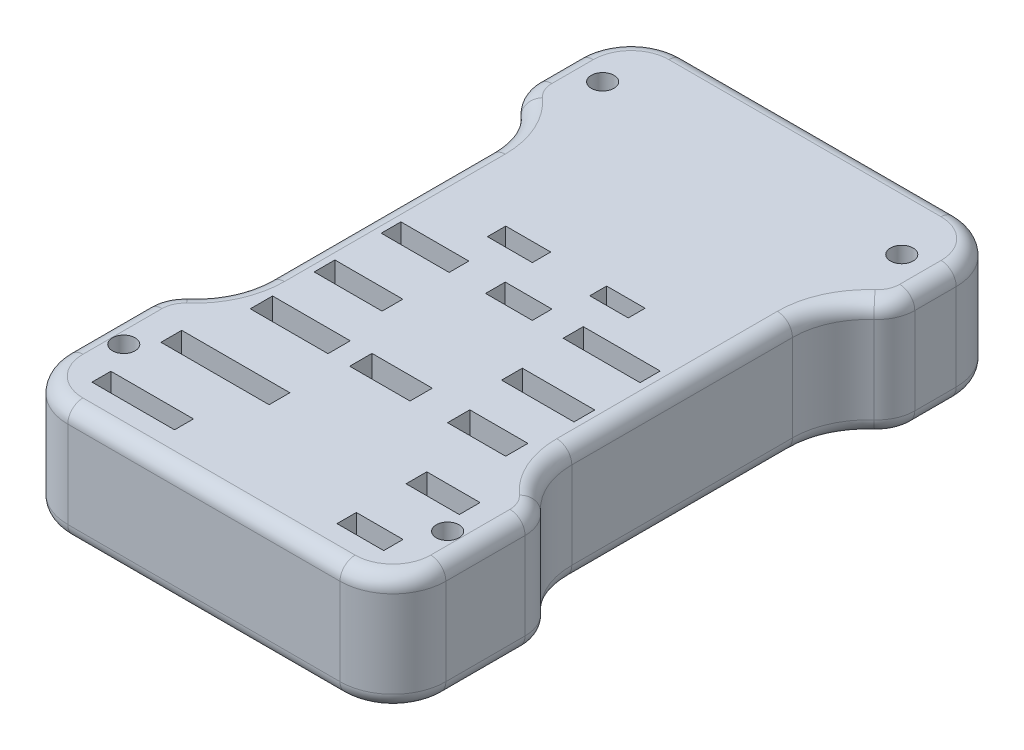
from build123d import *

# Parameters (mm, degrees)
BOSS_EXTRUDE1_DEPTH = 15.5
FILLET1_R           = 7
FILLET2_R           = 10
FILLET3_R           = 5
FILLET4_R           = 2
SKETCH2_R           = 1.5
SKETCH2_W           = 10.92280205
SKETCH2_H           = 2.497802755
SKETCH2_W_2         = 14.300247421
SKETCH2_H_2         = 2.745251167
SKETCH2_W_3         = 6.180006424
SKETCH2_H_3         = 2.556024723
SKETCH2_W_4         = 7.044858218
SKETCH2_W_5         = 10.276057193
SKETCH2_H_4         = 2.946282132
SKETCH2_W_6         = 7.976519918
SKETCH2_W_7         = 7.689077759
SKETCH2_W_8         = 8.982567476
SKETCH2_H_5         = 2.60403982
SKETCH2_W_9         = 6.180006423
SKETCH2_W_10        = 10.172310113
SKETCH2_H_6         = 2.663918404
SKETCH2_W_11        = 5.94485656
SKETCH2_H_7         = 2.427407937
SKETCH2_W_12        = 5.086155057
SKETCH2_H_8         = 2.229246052
SKETCH2_H_9         = 2.744285017
SKETCH2_W_13        = 9.577824458
CUT_EXTRUDE1_DEPTH  = 3.5


with BuildPart() as part:
    # Sketch1 → Boss-Extrude1 (new body)
    with BuildSketch(Plane(origin=(0, 0, 0), x_dir=(1, 0, 0), z_dir=(0, 1, 0))):
        Polygon((25, -40.75), (-25, -40.75), (-25, -20.75), (-20, -20.75), (-20, 25.75), (-25, 25.75), (-25, 40.75), (25, 40.75), (25, 25.75), (20, 25.75), (20, -20.75), (25, -20.75), align=None)
    extrude(amount=BOSS_EXTRUDE1_DEPTH)

    # Fillet1
    fillet1_edges = [part.edges().sort_by_distance(p)[0] for p in [
        (-25, 7.75, -40.75),
        (25, 7.75, -40.75),
        (25, 7.75, 40.75),
        (-25, 7.75, 40.75),
    ]]
    fillet(fillet1_edges, radius=FILLET1_R)

    # Fillet2
    # the kernel refuses this fillet: 10 mm, written as the material it adds along each edge
    with BuildSketch(Plane(origin=(-20, 0, 20.75), x_dir=(-1, 0, 0), z_dir=(0, 1, 0))) as fillet2_piece_1:
        with BuildLine():
            CenterArc((10, -8.660254038), FILLET2_R, 120, 60)
            Line((0, -8.660254038), (-0.2, -8.660254038))
            Line((-0.2, -8.660254038), (-0.2, 0))
            Line((-0.2, 0), (0, 0.2))
            ThreePointArc((0, 0.2), (2.5, 0.2), (4.9, 0.173205081))
            Line((4.9, 0.173205081), (5, 0))
        make_face()
    extrude(amount=15.5)
    with BuildSketch(Plane(origin=(-20, 0, -25.75), x_dir=(0, 0, 1), z_dir=(0, 1, 0))) as fillet2_piece_2:
        with BuildLine():
            CenterArc((8.660254038, -10), FILLET2_R, 90, 60)
            Line((0, -5), (-0.173205081, -4.9))
            ThreePointArc((-0.173205081, -4.9), (-0.2, -2.5), (-0.2, 0))
            Line((-0.2, 0), (0, 0.2))
            Line((0, 0.2), (8.660254038, 0.2))
            Line((8.660254038, 0.2), (8.660254038, 0))
        make_face()
    extrude(amount=15.5)
    with BuildSketch(Plane(origin=(20, 0, 20.75), x_dir=(1, 0, 0), z_dir=(0, 1, 0))) as fillet2_piece_3:
        with BuildLine():
            CenterArc((10, 8.660254038), FILLET2_R, 180, 60)
            Line((0, 8.660254038), (-0.2, 8.660254038))
            Line((-0.2, 8.660254038), (-0.2, 0))
            Line((-0.2, 0), (0, -0.2))
            ThreePointArc((0, -0.2), (2.5, -0.2), (4.9, -0.173205081))
            Line((4.9, -0.173205081), (5, 0))
        make_face()
    extrude(amount=15.5)
    with BuildSketch(Plane(origin=(20, 0, -25.75), x_dir=(0, 0, 1), z_dir=(0, 1, 0))) as fillet2_piece_4:
        with BuildLine():
            CenterArc((8.660254038, 10), FILLET2_R, 210, 60)
            Line((0, 5), (-0.173205081, 4.9))
            ThreePointArc((-0.173205081, 4.9), (-0.2, 2.5), (-0.2, 0))
            Line((-0.2, 0), (0, -0.2))
            Line((0, -0.2), (8.660254038, -0.2))
            Line((8.660254038, -0.2), (8.660254038, 0))
        make_face()
    extrude(amount=15.5)

    # Fillet3
    fillet3_edges = [part.edges().sort_by_distance(p)[0] for p in [
        (25, 7.75, -25.75),
        (25, 7.75, 20.75),
        (-25, 7.75, 20.75),
        (-25, 7.75, -25.75),
    ]]
    fillet(fillet3_edges, radius=FILLET3_R)

    # Fillet4
    fillet4_edges = [part.edges().sort_by_distance(p)[0] for p in [
        (0, 0, -40.75),
        (0, 15.5, -40.75),
        (-25, 0, -31.010042925),
        (25, 0, 28.510042925),
        (0, 0, 40.75),
        (22.949747468, 0, 38.699747468),
        (-22.949747468, 0, 38.699747468),
        (-22.949747468, 0, -38.699747468),
        (22.949747468, 0, -38.699747468),
        (-25, 15.5, -31.010042925),
        (0, 15.5, 40.75),
        (25, 15.5, 28.510042925),
        (22.949747468, 15.5, 38.699747468),
        (-22.949747468, 15.5, 38.699747468),
        (-22.949747468, 15.5, -38.699747468),
        (22.949747468, 15.5, -38.699747468),
        (-20, 0, -2.5),
        (-20, 15.5, -2.5),
        (20, 0, -2.5),
        (20, 15.5, -2.5),
        (-20.871290708, 15.5, 16.172228867),
        (-20.871290708, 0, -21.172228867),
        (20.871290708, 0, 16.172228867),
        (20.871290708, 15.5, -21.172228867),
        (-25, 0, 28.510042925),
        (-25, 15.5, 28.510042925),
        (25, 0, -31.010042925),
        (20.871290708, 0, -21.172228867),
        (-20.871290708, 0, 16.172228867),
        (-24.564354646, 0, -26.228844397),
        (24.564354646, 0, -26.228844397),
        (24.564354646, 0, 21.228844397),
        (-24.564354646, 0, 21.228844397),
        (25, 15.5, -31.010042925),
        (-20.871290708, 15.5, -21.172228867),
        (20.871290708, 15.5, 16.172228867),
        (-24.564354646, 15.5, -26.228844397),
        (24.564354646, 15.5, -26.228844397),
        (24.564354646, 15.5, 21.228844397),
        (-24.564354646, 15.5, 21.228844397),
    ]]
    fillet(fillet4_edges, radius=FILLET4_R)

    # Sketch2 → Cut-Extrude1 (cut)
    with BuildSketch(Plane(origin=(0, 15.5, 0), x_dir=(1, 0, 0), z_dir=(0, 1, 0))):
        with Locations(Location((-21.439879839, -29.907193015, 0), (0, 0, 270))):
            Circle(SKETCH2_R)
        with Locations(Location((21.392609924, -29.907193015, 0), (0, 0, 270))):
            Circle(SKETCH2_R)
        with Locations(Location((-19.83836984, 31.824604268, 0), (0, 0, 270))):
            Circle(SKETCH2_R)
        with Locations(Location((19.72370758, 31.824604268, 0), (0, 0, 270))):
            Circle(SKETCH2_R)
        with Locations((-13.747194041, -35.095106184)):
            Rectangle(SKETCH2_W, SKETCH2_H)
        with Locations((-12.058471356, -25.845093422)):
            Rectangle(SKETCH2_W_2, SKETCH2_H_2)
        with Locations((16.290511598, -35.0659952)):
            Rectangle(SKETCH2_W_3, SKETCH2_H_3)
        with Locations((16.72604395, -25.845093422)):
            Rectangle(SKETCH2_W_4, SKETCH2_H_2)
        with Locations((-12.000710148, -16.003419816)):
            Rectangle(SKETCH2_W_5, SKETCH2_H_4)
        with Locations((0, -16.003419816)):
            Rectangle(SKETCH2_W_6, SKETCH2_H_4)
        with Locations((12.791176086, -16.003419816)):
            Rectangle(SKETCH2_W_7, SKETCH2_H_4)
        with Locations((-12.647455006, 1.143849121)):
            Rectangle(SKETCH2_W_8, SKETCH2_H_5)
        with Locations((-0.251511889, 1.143849121)):
            Rectangle(SKETCH2_W_9, SKETCH2_H_5)
        with Locations((12.008853949, 1.173788413)):
            Rectangle(SKETCH2_W_10, SKETCH2_H_6)
        with Locations((-6.750471196, 7.68245568)):
            Rectangle(SKETCH2_W_11, SKETCH2_H_7)
        with Locations((6.361240217, 7.583374737)):
            Rectangle(SKETCH2_W_12, SKETCH2_H_8)
        with Locations((-12.647455006, -7.655884762)):
            Rectangle(SKETCH2_W_8, SKETCH2_H_9)
        with Locations((12.4382047, -7.655884762)):
            Rectangle(SKETCH2_W_13, SKETCH2_H_9)
    extrude(amount=-CUT_EXTRUDE1_DEPTH, mode=Mode.SUBTRACT)


solid = part.part
